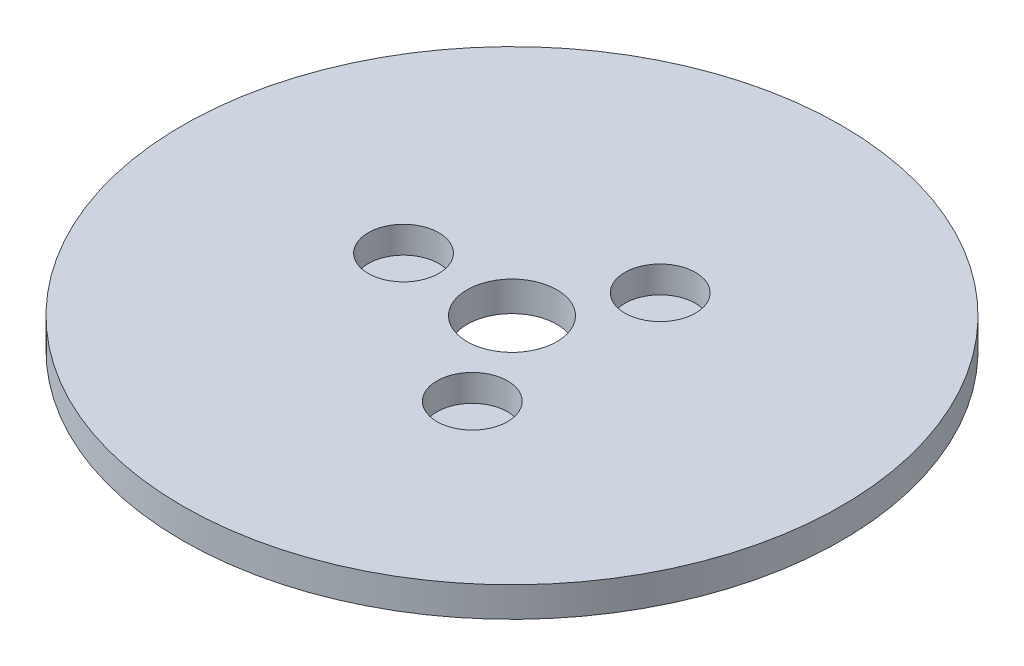
from build123d import *

# Parameters (mm, degrees)
SKETCH1_R           = 55
BOSS_EXTRUDE1_DEPTH = 5
SKETCH2_R           = 7.5
CUT_EXTRUDE1_DEPTH  = 78.942286341
SKETCH3_R           = 5.893874222
CUT_EXTRUDE2_DEPTH  = 4.465552073
CIRPATTERN1_COUNT   = 3


with BuildPart() as part:
    # Sketch1 → Boss-Extrude1 (new body)
    with BuildSketch(Plane(origin=(0, 0, 0), x_dir=(1, 0, 0), z_dir=(0, 1, 0))):
        Circle(SKETCH1_R)
    extrude(amount=BOSS_EXTRUDE1_DEPTH)

    # Sketch2 → Cut-Extrude1 (cut, through all)
    with BuildSketch(Plane(origin=(0, 0, 0), x_dir=(1, 0, 0), z_dir=(0, 1, 0))):
        Circle(SKETCH2_R)
    extrude(amount=CUT_EXTRUDE1_DEPTH, mode=Mode.SUBTRACT)

    # Sketch3 → Cut-Extrude2 (cut)
    with BuildSketch(Plane(origin=(0, 5, 0), x_dir=(1, 0, 0), z_dir=(0, 1, 0))):
        with Locations((-18.103654222, 0)):
            Circle(SKETCH3_R)
    cut_extrude2 = extrude(amount=-CUT_EXTRUDE2_DEPTH, mode=Mode.SUBTRACT)

    # CirPattern1: Cut-Extrude2 ×3 about axis
    cirpattern1_axis = Axis((0, 0, 0), (0, 1, 0))
    for i in range(1, CIRPATTERN1_COUNT):
        add(cut_extrude2.rotate(cirpattern1_axis, i * 360 / CIRPATTERN1_COUNT), mode=Mode.SUBTRACT)


solid = part.part
